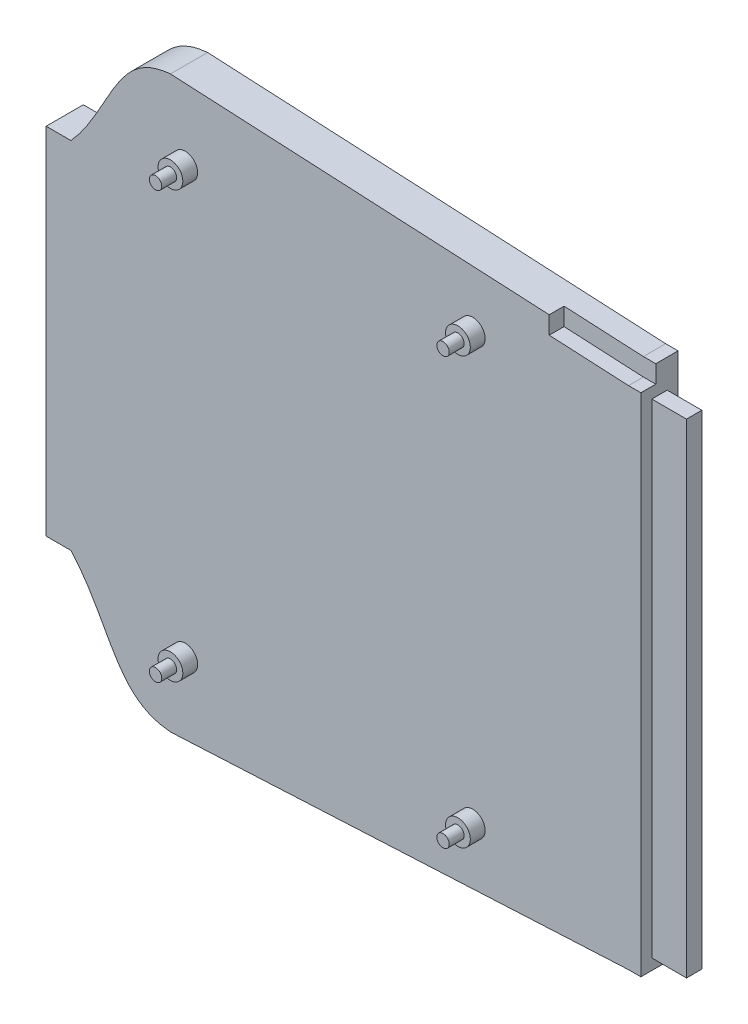
from build123d import *

# Parameters (mm, degrees)
STOCK_BATTERY_BASE_1_DEPTH   = 7.5
STOCK_BATTERY_BASE_1_2_DEPTH = 4.5
BOSS_EXTRUDE1_DEPTH          = 2.5
BOSS_EXTRUDE2_DEPTH          = 7
SKETCH3_R                    = 2.5
BOSS_EXTRUDE4_DEPTH          = 3
SKETCH4_R                    = 1.25
BOSS_EXTRUDE5_DEPTH          = 3


# Read off the part's stored shape, not the designer's step: Stock-battery base-1
with BuildPart() as part:
    # Stock-battery base-1 outline → Stock-battery base-1 (new body)
    with BuildSketch(Plane.XY):
        with BuildLine():
            Line((16.459100066, -58.832087736), (16.459100066, 43.22938712))
            Line((16.459100066, 43.22938712), (0.459100066, 44.038083245))
            Line((0.459100066, 44.038083245), (0.459100066, 47.61329436))
            Line((0.459100066, 47.61329436), (-75.963345356, 51.475952827))
            add(Edge.make_bspline(
                [(-75.963345356, 51.475952827), (-76.969760945, 51.385311169), (-77.956664013, 51.213742336), (-79.395866789, 50.78571401), (-79.86970863, 50.613871194), (-80.796837185, 50.204577199), (-81.240590365, 49.971323111), (-82.089787414, 49.449496549), (-82.495246976, 49.160946736), (-83.271465049, 48.533739024), (-83.643007435, 48.194375714), (-84.708444042, 47.116795042), (-85.333215001, 46.343374139), (-86.491296884, 44.737676097), (-87.023827607, 43.904896882), (-88.044872363, 42.211012893), (-88.533034054, 41.34968138), (-89.982900727, 38.756279626), (-90.93240726, 37.013628654), (-92.999467157, 33.650383947), (-94.114586107, 32.031232641), (-95.60337212, 30.287705281), (-95.819744565, 30.042891916), (-96.040899934, 29.801740739)],
                knots=[0, 0, 0, 0, 0.0625, 0.0625, 0.09375, 0.09375, 0.125, 0.125, 0.15625, 0.15625, 0.1875, 0.1875, 0.25, 0.25, 0.3125, 0.3125, 0.375, 0.375, 0.5, 0.5, 0.625, 0.625, 0.645748558, 0.645748558, 0.645748558, 0.645748558], degree=3))
            Line((-96.040899934, 29.801740739), (-101.040899934, 29.801740739))
            Line((-101.040899934, 29.801740739), (-101.040899934, -41.829259963))
            Line((-101.040899934, -41.829259963), (-96.040899934, -41.829259963))
            add(Edge.make_bspline(
                [(-96.040899934, -41.829259963), (-95.798899268, -42.093160096), (-95.56197213, -42.362136183), (-94.03954966, -44.156758027), (-92.923608678, -45.792412437), (-90.858487716, -49.170948695), (-89.911065512, -50.914960796), (-88.457766632, -53.51029646), (-87.967520262, -54.371999904), (-86.940892781, -56.06392928), (-86.404912323, -56.894254814), (-85.530671439, -58.091259413), (-85.227414802, -58.482089731), (-84.588818098, -59.241614046), (-84.254184704, -59.609132259), (-83.204929916, -60.651600397), (-82.440569541, -61.270576891), (-81.160629249, -62.042718444), (-80.719255742, -62.269433113), (-79.817314106, -62.660888928), (-79.3554021, -62.826549047), (-77.940467092, -63.243286827), (-76.954208328, -63.414201398), (-75.963345356, -63.503442328)],
                knots=[0.352672192, 0.352672192, 0.352672192, 0.352672192, 0.375, 0.375, 0.5, 0.5, 0.625, 0.625, 0.6875, 0.6875, 0.75, 0.75, 0.78125, 0.78125, 0.8125, 0.8125, 0.875, 0.875, 0.90625, 0.90625, 0.9375, 0.9375, 1, 1, 1, 1], degree=3))
            Line((-75.963345356, -63.503442328), (16.459100066, -58.832087736))
        make_face()
    extrude(amount=STOCK_BATTERY_BASE_1_DEPTH)

    # Stock-battery base-1 2 outline → Stock-battery base-1 2 (add)
    with BuildSketch(Plane.XY):
        Polygon((16.459100066, 43.22938712), (16.459100066, 46.804598235), (0.459100066, 47.61329436), (0.459100066, 44.038083245), align=None)
    extrude(amount=STOCK_BATTERY_BASE_1_2_DEPTH)

    # Sketch1 → Boss-Extrude1 (add)
    with BuildSketch(Plane(origin=(16.459100066, 0, 0), x_dir=(0, 0, -1), z_dir=(1, 0, 0))):
        Polygon((0, -58.832087736), (0, 46.804598235), (-4.5, 46.804598235), (-4.5, 43.22938712), (-7.5, 43.22938712), (-7.5, -58.832087736), align=None)
    extrude(amount=BOSS_EXTRUDE1_DEPTH)

    # Sketch2 → Boss-Extrude2 (add)
    with BuildSketch(Plane(origin=(18.959100066, 0, 0), x_dir=(0, 0, -1), z_dir=(1, 0, 0))):
        Polygon((-2.3, 41.02938712), (-2.2, 41.02938712), (-2.2, -56.632087736), (-5.3, -56.632087736), (-5.3, 41.02938712), align=None)
    extrude(amount=BOSS_EXTRUDE2_DEPTH)

    # Sketch3 → Boss-Extrude4 (add)
    with BuildSketch(Plane.XY.offset(7.5)):
        with Locations(Location((-72.963345356, 36.964917072, 0), (0, 0, 180))):
            Circle(SKETCH3_R)
        with Locations(Location((-14.960454045, 36.964917072, 0), (0, 0, 180))):
            Circle(SKETCH3_R)
        with Locations(Location((-14.960454045, -48.992436296, 0), (0, 0, 180))):
            Circle(SKETCH3_R)
        with Locations(Location((-72.963345356, -48.992436296, 0), (0, 0, 180))):
            Circle(SKETCH3_R)
    extrude(amount=BOSS_EXTRUDE4_DEPTH)

    # Sketch4 → Boss-Extrude5 (add)
    with BuildSketch(Plane.XY.offset(10.5)):
        with Locations((-72.963345356, 36.964917072)):
            Circle(SKETCH4_R)
        with Locations((-14.960454045, 36.964917072)):
            Circle(SKETCH4_R)
        with Locations((-72.963345356, -48.992436296)):
            Circle(SKETCH4_R)
        with Locations((-14.960454045, -48.992436296)):
            Circle(SKETCH4_R)
    extrude(amount=BOSS_EXTRUDE5_DEPTH)


solid = part.part
